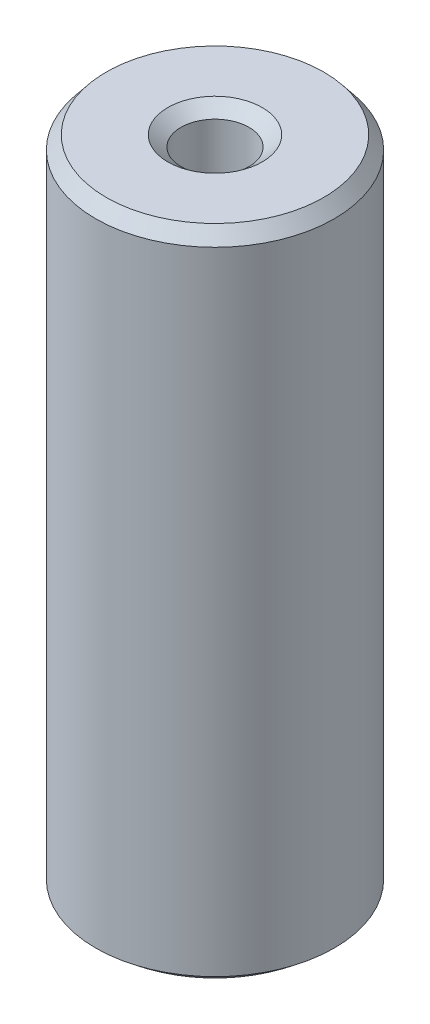
from build123d import *
from OCP.BRepFilletAPI import BRepFilletAPI_MakeChamfer

# Parameters (mm, degrees)
SKETCH1_R           = 5
BOSS_EXTRUDE1_DEPTH = 27.471990798
SKETCH2_R           = 1.426565073
CUT_EXTRUDE1_DEPTH  = 29.367415787
CHAMFER1_SIZE       = 0.551712752
CHAMFER1_SIZE2      = 0.4428865


with BuildPart() as part:
    # Sketch1 → Boss-Extrude1 (new body)
    with BuildSketch(Plane(origin=(0, 0, 0), x_dir=(1, 0, 0), z_dir=(0, 1, 0))):
        Circle(SKETCH1_R)
    extrude(amount=BOSS_EXTRUDE1_DEPTH)

    # Sketch2 → Cut-Extrude1 (cut, through all)
    with BuildSketch(Plane(origin=(0, 0, 0), x_dir=(1, 0, 0), z_dir=(0, 1, 0))):
        Circle(SKETCH2_R)
    extrude(amount=CUT_EXTRUDE1_DEPTH, mode=Mode.SUBTRACT)

    # Chamfer1: one chamfer whose edges measure the first distance from different faces: ONE call of the kernel's chamfer builder (chamfer() names one face for all edges)
    chamfer1_edges_1 = [part.edges().sort_by_distance(p)[0] for p in [
        (-1.426565073, 27.471990798, 0),
    ]]
    chamfer1_side_1 = [part.faces().sort_by_distance(p)[0] for p in [
        (-4.858578644, 27.471990798, 0),
    ]]
    chamfer1_edges_2 = [part.edges().sort_by_distance(p)[0] for p in [
        (-1.426565073, 0, 0),
    ]]
    chamfer1_side_2 = [part.faces().sort_by_distance(p)[0] for p in [
        (-1.426565073, 13.735995399, 0),
    ]]
    chamfer1_edges_3 = [part.edges().sort_by_distance(p)[0] for p in [
        (-5, 0, 0),
    ]]
    chamfer1_side_3 = [part.faces().sort_by_distance(p)[0] for p in [
        (-4.858578644, 0, 0),
    ]]
    chamfer1_edges_4 = [part.edges().sort_by_distance(p)[0] for p in [
        (-5, 27.471990798, 0),
    ]]
    chamfer1_side_4 = [part.faces().sort_by_distance(p)[0] for p in [
        (-5, 13.735995399, 0),
    ]]
    chamfer1 = BRepFilletAPI_MakeChamfer(part.part.solid().wrapped)
    for e in chamfer1_edges_1:
        chamfer1.Add(CHAMFER1_SIZE, CHAMFER1_SIZE2, e.wrapped, chamfer1_side_1[0].wrapped)  # the first distance lies on this face
    for e in chamfer1_edges_2:
        chamfer1.Add(CHAMFER1_SIZE, CHAMFER1_SIZE2, e.wrapped, chamfer1_side_2[0].wrapped)  # the first distance lies on this face
    for e in chamfer1_edges_3:
        chamfer1.Add(CHAMFER1_SIZE, CHAMFER1_SIZE2, e.wrapped, chamfer1_side_3[0].wrapped)  # the first distance lies on this face
    for e in chamfer1_edges_4:
        chamfer1.Add(CHAMFER1_SIZE, CHAMFER1_SIZE2, e.wrapped, chamfer1_side_4[0].wrapped)  # the first distance lies on this face
    add(Compound.cast(chamfer1.Shape()), mode=Mode.REPLACE)


solid = part.part
